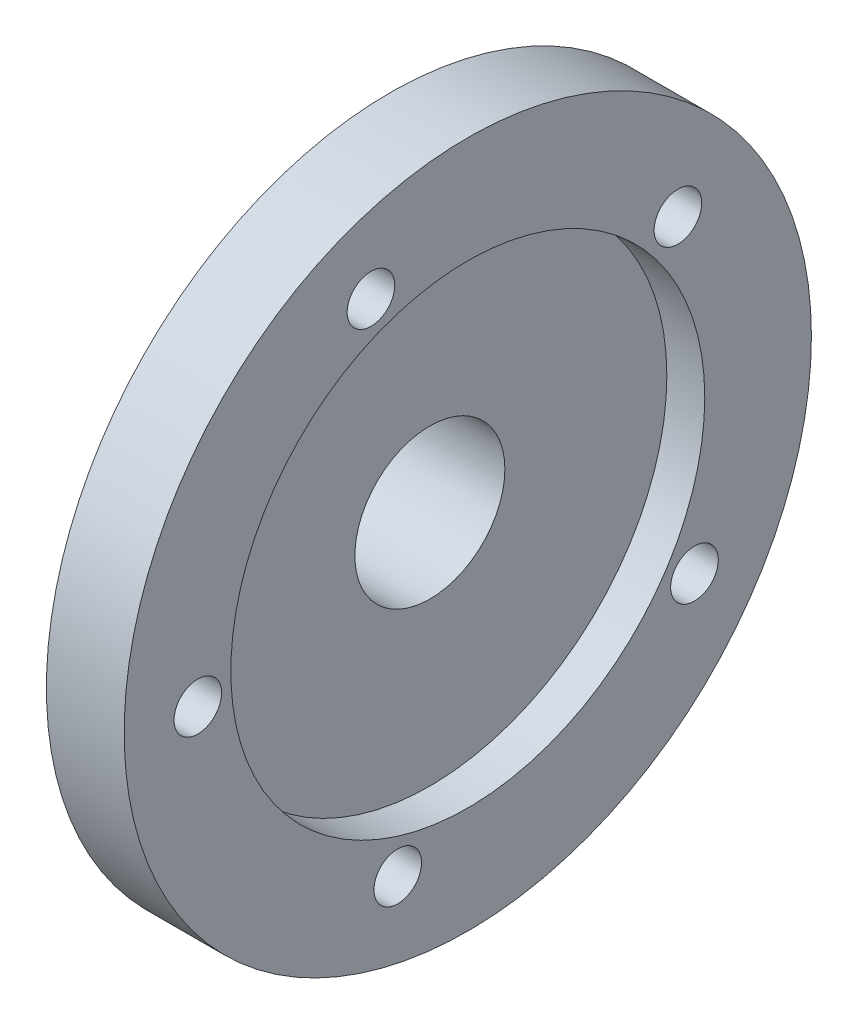
from build123d import *

# Parameters (mm, degrees)
SKETCH2_R          = 2.5527
CUT_EXTRUDE1_DEPTH = 56.074558476


with BuildPart() as part:
    # Sketch1 → Revolve1 (revolve)
    with BuildSketch(Plane.XY):
        Polygon((-27.857278892, 8.0391), (-14.024094998, 8.0391), (-14.024094998, 25.4), (-9.960094998, 25.4), (-9.960094998, 36.83), (-18.295757287, 36.83), (-27.857278892, 17.801339222), align=None)
    revolve(axis=Axis((0, 0, 0), (-1, 0, 0)))

    # Sketch2 → Cut-Extrude1 (cut, through all)
    with BuildSketch(Plane(origin=(-9.960094998, 0, 0), x_dir=(0, 0, -1), z_dir=(1, 0, 0))):
        with Locations((-28.933185517, -1.509605446)):
            Circle(SKETCH2_R)
        with Locations((-10.376566123, 27.050600885)):
            Circle(SKETCH2_R)
        with Locations((24.294762603, -15.785203288)):
            Circle(SKETCH2_R)
        with Locations((-7.505125929, -27.983588361)):
            Circle(SKETCH2_R)
        with Locations((22.520114966, 18.22779621)):
            Circle(SKETCH2_R)
    extrude(amount=-CUT_EXTRUDE1_DEPTH, mode=Mode.SUBTRACT)


solid = part.part
